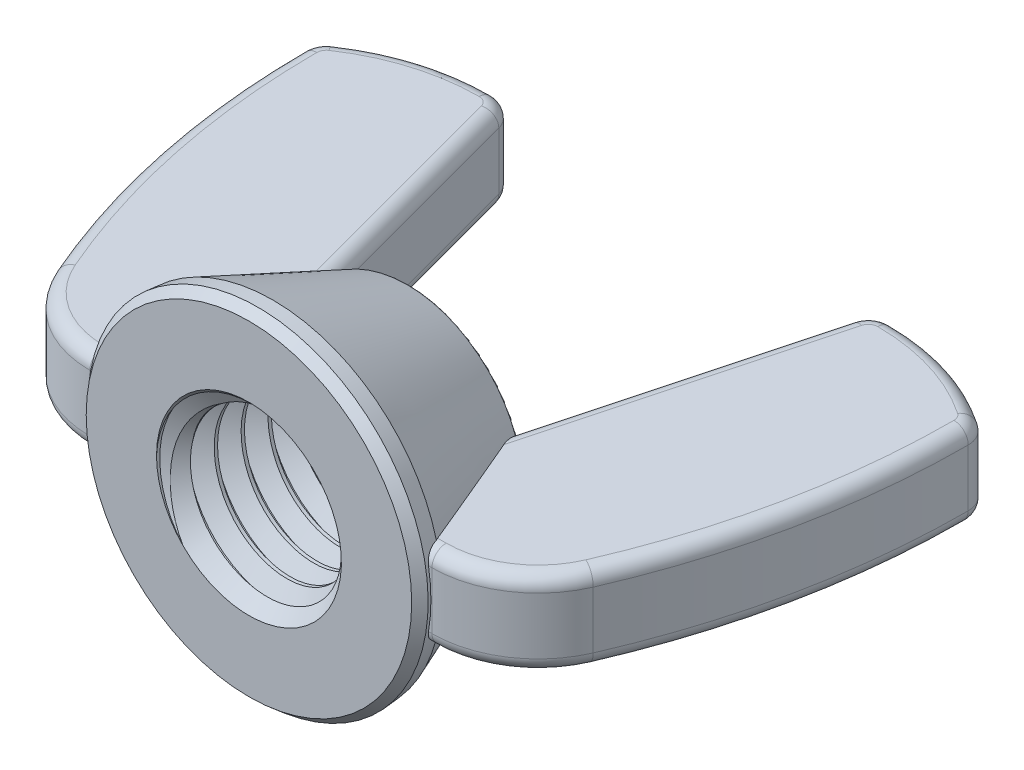
from build123d import *

# Parameters (mm, degrees)
EXTRUDE2_DEPTH     = 3.67109375
SKETCH3_R          = 14.684375
EXTRUDE1_DEPTH     = 2.0574
EXTRUDE1_DRAFT     = -5
SKETCH15_R         = 14.504375824
EXTRUDE3_DEPTH     = 11.6586
EXTRUDE3_TAPER     = 21.85610725
FILLET3_R          = 0.254
SKETCH4_R          = 7.9375
CUT_EXTRUDE1_DEPTH = 50.837450719
SWEEP1_PITCH       = 2.309090909
SKETCH7_R          = 14.684375
CUT_EXTRUDE2_DEPTH = 50.837450748
SKETCH8_R          = 14.504375824
CUT_EXTRUDE3_DEPTH = 41.332876826
SKETCH11_R         = 7.8867
CUT_EXTRUDE5_DEPTH = 41.33287679
CUT_EXTRUDE5_TAPER = 45
CHAMFER1_SIZE      = 0.771525
CHAMFER1_SIZE2     = 0.712165677
FILLET4_R          = 1.223697917


with BuildPart() as part:
    # Sketch13 → Extrude2 (new, symmetric)
    with BuildSketch(Plane(origin=(0, 0, 0), x_dir=(1, 0, 0), z_dir=(0, 1, 0))):
        with BuildLine():
            Line((9.007217386, 1.0287), (14.684375, 1.0287))
            ThreePointArc((14.684375, 1.0287), (19.684030946, 2.522957171), (23.04380221, 6.51561307))
            ThreePointArc((23.04380221, 6.51561307), (27.177634051, 19.562742365), (28.575, 33.177569464))
            ThreePointArc((28.575, 33.177569464), (28.336272022, 34.135055086), (27.675975457, 34.868388715))
            ThreePointArc((27.675975457, 34.868388715), (22.632397111, 37.274052183), (17.105851222, 38.1))
            ThreePointArc((17.105851222, 38.1), (15.864284402, 37.678544855), (15.135848854, 36.588364016))
            Line((15.135848854, 36.588364016), (9.007217386, 13.716))
            Line((9.007217386, 13.716), (9.007217386, 1.0287))
        make_face()
    extrude(amount=EXTRUDE2_DEPTH, both=True)

    # Fillet4
    fillet4_edges = [part.edges().sort_by_distance(p)[0] for p in [
        (19.684030946, 3.67109375, -2.522957171),
        (11.845796193, -3.67109375, -1.0287),
        (27.177634051, 3.67109375, -19.562742365),
        (28.336272022, 3.67109375, -34.135055086),
        (22.632397111, 3.67109375, -37.274052183),
        (15.864284402, 3.67109375, -37.678544855),
        (12.07153312, 3.67109375, -25.152182008),
        (11.845796193, 3.67109375, -1.0287),
        (12.07153312, -3.67109375, -25.152182008),
        (15.864284402, -3.67109375, -37.678544855),
        (22.632397111, -3.67109375, -37.274052183),
        (28.336272022, -3.67109375, -34.135055086),
        (27.177634051, -3.67109375, -19.562742365),
        (19.684030946, -3.67109375, -2.522957171),
    ]]
    fillet(fillet4_edges, radius=FILLET4_R)


with BuildPart() as body_2:
    # Sketch3 → Extrude1 (with draft: the straight prism first)
    with BuildSketch(Plane.XY):
        Circle(SKETCH3_R)
    extrude(amount=-EXTRUDE1_DEPTH)
    # Extrude1: the draft: its side faces are tilted about the plane it starts from
    extrude1_sides = [body_2.faces().sort_by_distance(p)[0] for p in [
        (-14.684375, 0, -1.0287),
    ]]
    draft(extrude1_sides, Plane.XY, EXTRUDE1_DRAFT)

    # Sketch15 → Extrude3 (add)
    with BuildSketch(Plane(origin=(0, 0, -2.0574), x_dir=(-1, 0, 0), z_dir=(0, 0, -1))):
        Circle(SKETCH15_R)
    extrude(amount=EXTRUDE3_DEPTH, taper=EXTRUDE3_TAPER)

    # Fillet3
    fillet3_edges = [body_2.edges().sort_by_distance(p)[0] for p in [
        (9.828020142, 0, -13.716),
    ]]
    fillet(fillet3_edges, radius=FILLET3_R)

    # Sketch4 → Cut-Extrude1 (cut, through all)
    with BuildSketch(Plane.XY):
        Circle(SKETCH4_R)
    extrude(amount=-CUT_EXTRUDE1_DEPTH, mode=Mode.SUBTRACT)

    # Sweep1: the profile of Sketch6 profile screwed along a right-hand helix of 7.315 turns, 6 arcs to a turn; built about Z, then put on its axis
    sweep1_z = Axis((0, 0, 0), (0, 0, 1))
    sweep1_corners = [(7.9378, 0, -2.020627751), (6.43770146, 0, -1.154545455), (6.43770146, 0, -0.865909091), (7.9378, 0, 0.000173205)]
    with BuildLine(mode=Mode.PRIVATE) as sweep1_profile:
        Line(sweep1_corners[0], sweep1_corners[1])
        Line(sweep1_corners[1], sweep1_corners[2])
        Line(sweep1_corners[2], sweep1_corners[3])
        Line(sweep1_corners[3], sweep1_corners[0])
    sweep1_cap = Face(sweep1_profile.wire())
    sweep1_turn_angles = [0, 30, 60, 90, 120, 150, 180, 210, 240, 270, 300, 330, 360]
    sweep1_turn_weights = [1, 0.8660254037844387, 1, 0.8660254037844387, 1, 0.8660254037844387, 1, 0.8660254037844387, 1, 0.8660254037844387, 1, 0.8660254037844387, 1]
    sweep1_turn_rails = [Edge.make_bspline([Vector(p[0], p[1], 0).rotate(sweep1_z, sweep1_turn_angles[k]) / sweep1_turn_weights[k] + Vector(0, 0, p[2] + SWEEP1_PITCH * sweep1_turn_angles[k] / 360) for k in range(13)], [0, 0, 0, 1, 1, 2, 2, 3, 3, 4, 4, 5, 5, 6, 6, 6], 2, sweep1_turn_weights) for p in sweep1_corners]
    sweep1_turn_sides = [Face.make_surface_from_curves(sweep1_turn_rails[p[0]], sweep1_turn_rails[p[1]]) for p in [(0, 1), (1, 2), (2, 3), (3, 0)]]
    sweep1_turn = Solid(Shell([*sweep1_turn_sides, sweep1_cap, sweep1_cap.rotate(sweep1_z, 360).moved(Location((0, 0, SWEEP1_PITCH * 360 / 360)))]))
    sweep1_last_angles = [2520, 2550, 2580, 2606.7, 2633.4]
    sweep1_last_weights = [1, 0.8660254037844387, 1, 0.893371388327773, 1]
    sweep1_last_rails = [Edge.make_bspline([Vector(p[0], p[1], 0).rotate(sweep1_z, sweep1_last_angles[k]) / sweep1_last_weights[k] + Vector(0, 0, p[2] + SWEEP1_PITCH * sweep1_last_angles[k] / 360) for k in range(5)], [0, 0, 0, 1, 1, 2, 2, 2], 2, sweep1_last_weights) for p in sweep1_corners]
    sweep1_last_sides = [Face.make_surface_from_curves(sweep1_last_rails[p[0]], sweep1_last_rails[p[1]]) for p in [(0, 1), (1, 2), (2, 3), (3, 0)]]
    sweep1_last = Solid(Shell([*sweep1_last_sides, sweep1_cap.rotate(sweep1_z, 2520).moved(Location((0, 0, SWEEP1_PITCH * 2520 / 360))), sweep1_cap.rotate(sweep1_z, 2633.4).moved(Location((0, 0, SWEEP1_PITCH * 2633.4 / 360)))]))
    sweep1_each = [*[sweep1_turn.moved(Location((0, 0, SWEEP1_PITCH * i))) for i in range(7)], sweep1_last]
    add(Plane(origin=(0, 0, 0), x_dir=(-1, 0, 0), z_dir=(0, 0, -1)) * Compound([sweep1_each[i] for i in range(0, 8, 2)]))
    add(Plane(origin=(0, 0, 0), x_dir=(-1, 0, 0), z_dir=(0, 0, -1)) * Compound([sweep1_each[i] for i in range(1, 8, 2)]))

    # Sketch7 → Cut-Extrude2 (cut, through all)
    with BuildSketch(Plane.XY):
        Circle(SKETCH7_R)
    extrude(amount=CUT_EXTRUDE2_DEPTH, mode=Mode.SUBTRACT)

    # Sketch8 → Cut-Extrude3 (cut, through all)
    with BuildSketch(Plane.XY.offset(-13.716)):
        Circle(SKETCH8_R)
    extrude(amount=-CUT_EXTRUDE3_DEPTH, mode=Mode.SUBTRACT)

    # Cut-Extrude4 cone 1 section (through the dimple's axis) → Cut-Extrude4 (revolve, cut)
    with BuildSketch(Plane(origin=(0, 0, 0), x_dir=(0, -1, 0), z_dir=(1, 0, 0))):
        Polygon((0, 0), (7.9375, 0), (0, 7.9375), align=None)
    revolve(axis=Axis((0, 0, 0), (0, 0, -1)), mode=Mode.SUBTRACT)

    # Sketch11 → Cut-Extrude5 (cut, through all)
    with BuildSketch(Plane.XY.offset(-13.716)):
        Circle(SKETCH11_R)
    extrude(amount=CUT_EXTRUDE5_DEPTH, taper=CUT_EXTRUDE5_TAPER, mode=Mode.SUBTRACT)

    # Chamfer1
    chamfer1_edges = [body_2.edges().sort_by_distance(p)[0] for p in [
        (-14.684375, 0, 0),
    ]]
    chamfer1_side = [body_2.faces().sort_by_distance(p)[0] for p in [
        (-14.594375412, 0, -1.0287),
    ]]
    chamfer(chamfer1_edges, length=CHAMFER1_SIZE, length2=CHAMFER1_SIZE2, reference=chamfer1_side[0])


with BuildPart() as body_3:
    # Mirror6: mirrored copy
    add(part.part.mirror(Plane(origin=(0, 0, 0), x_dir=(0, 0, 1), z_dir=(1, 0, 0))))

    # Combine2: union part, body 2
    add(part.part)
    add(body_2.part)


solid = body_3.part
